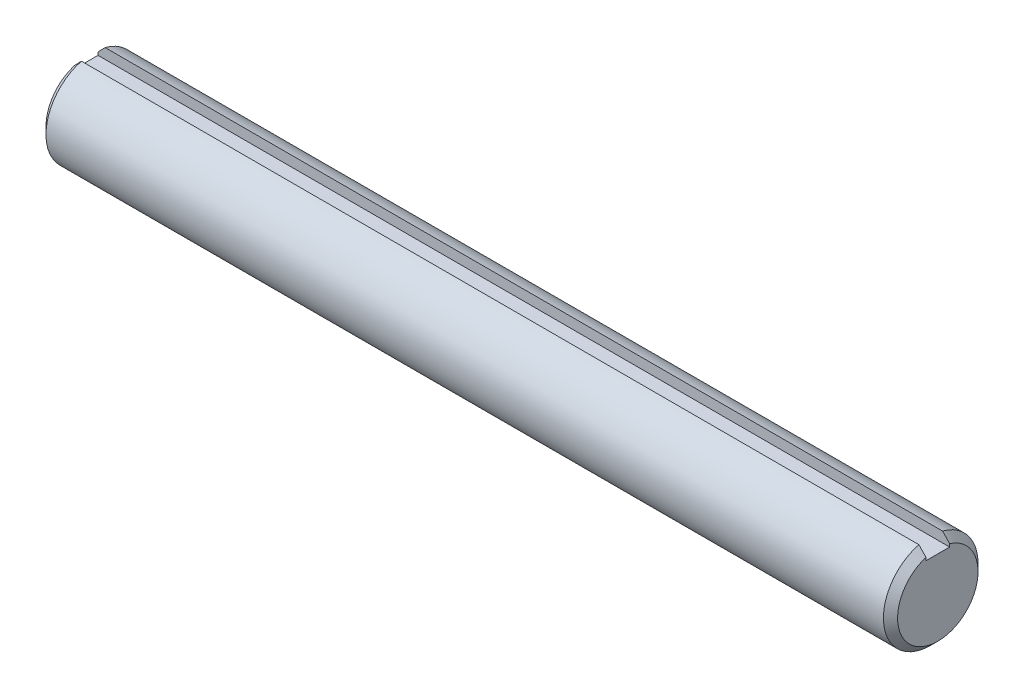
from build123d import *

# Parameters (mm, degrees)
SKETCH1_R           = 12.7
EXTRUDE1_DEPTH      = 114.3
CHAMFER1_SIZE       = 1.905
EXTRUDE2_DEPTH      = 116.702506455
EXTRUDE2_DEPTH_BACK = 116.702506455
SKETCH3_W           = 6.35
SKETCH3_H           = 3.175


with BuildPart() as part:
    # Sketch1 → Extrude1 (new, symmetric)
    with BuildSketch(Plane(origin=(0, 0, 0), x_dir=(0, 0, -1), z_dir=(1, 0, 0))):
        Circle(SKETCH1_R)
    extrude(amount=EXTRUDE1_DEPTH, both=True)

    # Chamfer1
    chamfer1_edges = [part.edges().sort_by_distance(p)[0] for p in [
        (-114.3, 0, 12.7),
        (114.3, 0, 12.7),
    ]]
    chamfer(chamfer1_edges, length=CHAMFER1_SIZE)

    # Sketch3 → Extrude2 (cut, two sides: drawn at the far end of the back side and taken through both)
    with BuildSketch(Plane(origin=(0, 0, 0), x_dir=(0, 0, -1), z_dir=(1, 0, 0)).offset(-EXTRUDE2_DEPTH_BACK)):
        with Locations((0, 11.1125)):
            Rectangle(SKETCH3_W, SKETCH3_H)
    extrude(amount=EXTRUDE2_DEPTH + EXTRUDE2_DEPTH_BACK, mode=Mode.SUBTRACT)


solid = part.part
